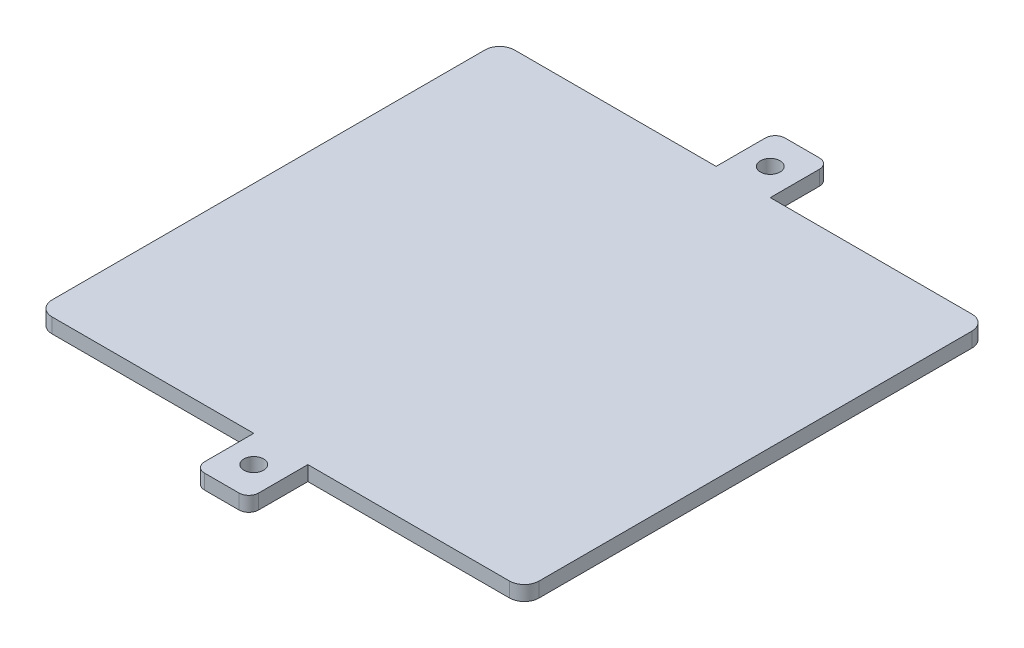
from build123d import *

# Parameters (mm, degrees)
RESSALTO_EXTRUS_O2_DEPTH = 3
ESBO_O1_8_R              = 2
RESSALTO_EXTRUS_O3_DEPTH = 3


with BuildPart() as part:
    # Esboço1 → Ressalto-extrusão2 (new body)
    with BuildSketch(Plane(origin=(0, 0, 0), x_dir=(1, 0, 0), z_dir=(0, 1, 0))):
        with BuildLine():
            ThreePointArc((-3, 0), (-2.121320344, -2.121320344), (0, -3))
            Line((0, -3), (41, -3))
            Line((41, -3), (52, -3))
            Line((52, -3), (93, -3))
            ThreePointArc((93, -3), (95.121320344, -2.121320344), (96, 0))
            Line((96, 0), (96, 38.5))
            Line((96, 38.5), (96, 49.5))
            Line((96, 49.5), (96, 88))
            ThreePointArc((96, 88), (95.121320344, 90.121320344), (93, 91))
            Line((93, 91), (52, 91))
            Line((52, 91), (41, 91))
            Line((41, 91), (0, 91))
            ThreePointArc((0, 91), (-2.121320344, 90.121320344), (-3, 88))
            Line((-3, 88), (-3, 0))
        make_face()
    extrude(amount=RESSALTO_EXTRUS_O2_DEPTH)

    # Esboço1<8> → Ressalto-extrusão3 (add)
    # profile 1 of 2: a face of its own
    with BuildSketch(Plane(origin=(0, 0, 0), x_dir=(1, 0, 0), z_dir=(0, 1, 0))):
        with BuildLine():
            Line((52, -3), (41, -3))
            Line((41, -3), (41, -13))
            ThreePointArc((41, -13), (41.585786438, -14.414213562), (43, -15))
            Line((43, -15), (50, -15))
            ThreePointArc((50, -15), (51.414213562, -14.414213562), (52, -13))
            Line((52, -13), (52, -3))
        make_face()
        with Locations((46.5, -8.5)):
            Circle(ESBO_O1_8_R, mode=Mode.SUBTRACT)
    # profile 2 of 2: a face of its own
    with BuildSketch(Plane(origin=(0, 0, 0), x_dir=(1, 0, 0), z_dir=(0, 1, 0))):
        with BuildLine():
            Line((41, 101), (41, 91))
            Line((41, 91), (52, 91))
            Line((52, 91), (52, 101))
            ThreePointArc((52, 101), (51.414213562, 102.414213562), (50, 103))
            Line((50, 103), (43, 103))
            ThreePointArc((43, 103), (41.585786438, 102.414213562), (41, 101))
        make_face()
        with Locations((46.5, 96.5)):
            Circle(ESBO_O1_8_R, mode=Mode.SUBTRACT)
    extrude(amount=RESSALTO_EXTRUS_O3_DEPTH)


solid = part.part
